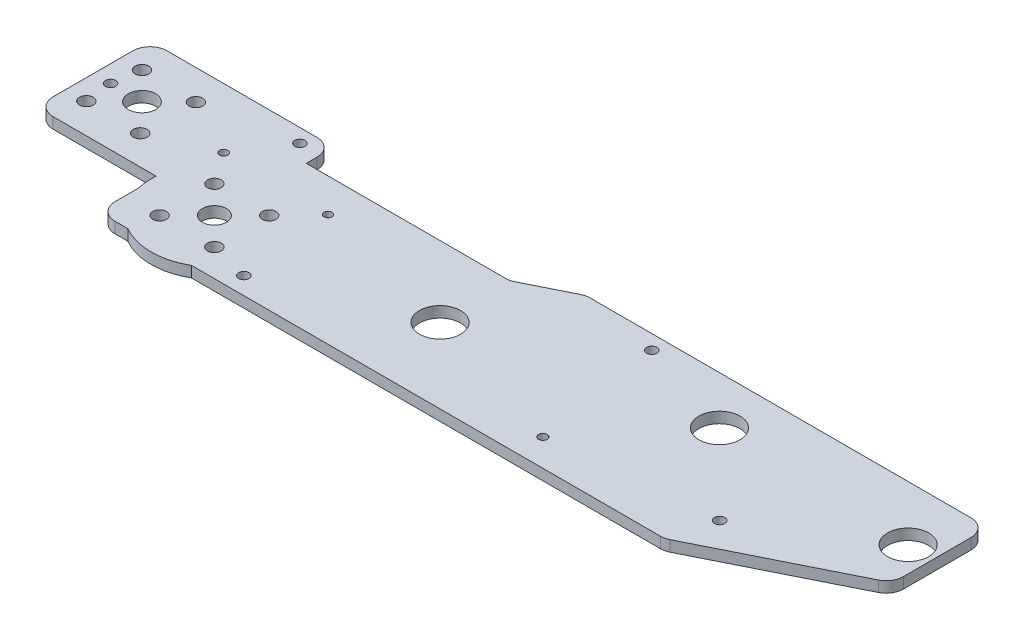
from build123d import *

# Parameters (mm, degrees)
SKETCH1_W           = 210
SKETCH1_H           = 50
SKETCH1_R           = 1.211665018
SKETCH1_R_2         = 1.165617118
SKETCH1_R_3         = 1.5
SKETCH1_R_4         = 1.25
SKETCH1_R_5         = 1.517273905
SKETCH1_R_6         = 3.4
BOSS_EXTRUDE1_DEPTH = 3.175
SKETCH2_R           = 2
CUT_EXTRUDE1_DEPTH  = 10
SKETCH3_R           = 6
SKETCH3_R_2         = 0.586995366
CUT_EXTRUDE2_DEPTH  = 57.15
CUT_EXTRUDE7_DEPTH  = 10
FILLET3_R           = 5
SKETCH11_R          = 18.5
SKETCH11_R_2        = 2
BOSS_EXTRUDE4_DEPTH = 3.175
SKETCH16_W          = 18.257640281
SKETCH16_H          = 3.175
BOSS_EXTRUDE7_DEPTH = 8.128
SKETCH17_W          = 33.3
SKETCH17_H          = 3.175
BOSS_EXTRUDE8_DEPTH = 35.56
SKETCH18_R          = 2
CUT_EXTRUDE8_DEPTH  = 9
SKETCH19_R          = 4
CUT_EXTRUDE9_DEPTH  = 40
FILLET4_R           = 5
SKETCH20_R          = 3.5
CUT_EXTRUDE10_DEPTH = 10
SKETCH21_R          = 1.5
CUT_EXTRUDE11_DEPTH = 10
SKETCH22_R          = 1.5
CUT_EXTRUDE12_DEPTH = 10
SKETCH24_R          = 1.5
CUT_EXTRUDE13_DEPTH = 10


with BuildPart() as part:
    # Sketch1 → Boss-Extrude1 (new body)
    with BuildSketch(Plane(origin=(0, 0, 0), x_dir=(1, 0, 0), z_dir=(0, 1, 0))):
        with Locations((105, -25)):
            Rectangle(SKETCH1_W, SKETCH1_H)
        with Locations((3.489526233, -16.787661112)):
            Circle(SKETCH1_R, mode=Mode.SUBTRACT)
        with Locations((34.37258772, -17.194005245)):
            Circle(SKETCH1_R_2, mode=Mode.SUBTRACT)
        with Locations((37.520749958, -44.921198121)):
            Circle(SKETCH1_R_3, mode=Mode.SUBTRACT)
        with Locations((122, -42.058139805)):
            Circle(SKETCH1_R_4, mode=Mode.SUBTRACT)
        with Locations((168.975233936, -37.403209633)):
            Circle(SKETCH1_R_5, mode=Mode.SUBTRACT)
        with Locations((78.01026379, -28.1)):
            Circle(SKETCH1_R_6, mode=Mode.SUBTRACT)
    extrude(amount=BOSS_EXTRUDE1_DEPTH)

    # Sketch2 → Cut-Extrude1 (cut)
    with BuildSketch(Plane(origin=(0, 3.175, 0), x_dir=(1, 0, 0), z_dir=(0, 1, 0))):
        with Locations((10, -26)):
            Circle(SKETCH2_R)
        with Locations((10, -42)):
            Circle(SKETCH2_R)
        with Locations((26, -26)):
            Circle(SKETCH2_R)
        with Locations((26, -42)):
            Circle(SKETCH2_R)
    extrude(amount=-CUT_EXTRUDE1_DEPTH, mode=Mode.SUBTRACT)

    # Sketch3 → Cut-Extrude2 (cut)
    with BuildSketch(Plane(origin=(0, 3.175, 0), x_dir=(1, 0, 0), z_dir=(0, 1, 0))):
        with Locations((78.01026379, -28.1)):
            Circle(SKETCH3_R)
        with Locations((145.531297368, -14)):
            Circle(SKETCH3_R)
        with Locations((18, -34)):
            Circle(SKETCH3_R_2)
        with Locations((202.646291021, -16)):
            Circle(SKETCH3_R)
    extrude(amount=-CUT_EXTRUDE2_DEPTH, mode=Mode.SUBTRACT)

    # Sketch10 → Cut-Extrude7 (cut)
    with BuildSketch(Plane(origin=(0, 3.175, 0), x_dir=(1, 0, 0), z_dir=(0, 1, 0))):
        Polygon((210, -27.859435908), (165.502877994, -50), (210, -50), align=None)
        Polygon((92.532613397, 0), (77.65477062, -7.402812063), (0, -7.402812063), (0, 0), align=None)
    extrude(amount=-CUT_EXTRUDE7_DEPTH, mode=Mode.SUBTRACT)

    # Fillet3
    fillet3_edges = [part.edges().sort_by_distance(p)[0] for p in [
        (77.65477062, 1.5875, 7.402812063),
        (92.532613397, 1.5875, 0),
        (210, 1.5875, 0),
        (210, 1.5875, 27.859435908),
        (165.502877994, 1.5875, 50),
    ]]
    fillet(fillet3_edges, radius=FILLET3_R)

    # Sketch11 → Boss-Extrude4 (add)
    with BuildSketch(Plane(origin=(0, 3.175, 0), x_dir=(1, 0, 0), z_dir=(0, 1, 0))):
        with Locations((18, -34)):
            Circle(SKETCH11_R)
        with Locations((10, -26)):
            Circle(SKETCH11_R_2, mode=Mode.SUBTRACT)
        with Locations((10, -42)):
            Circle(SKETCH11_R_2, mode=Mode.SUBTRACT)
        with Locations((26, -26)):
            Circle(SKETCH11_R_2, mode=Mode.SUBTRACT)
        with Locations((26, -42)):
            Circle(SKETCH11_R_2, mode=Mode.SUBTRACT)
    extrude(amount=-BOSS_EXTRUDE4_DEPTH)

    # Sketch16 → Boss-Extrude7 (add)
    with BuildSketch(Plane(origin=(0, 0, 7.402812063), x_dir=(-1, 0, 0), z_dir=(0, 0, -1))):
        with Locations((-9.128820141, 1.5875)):
            Rectangle(SKETCH16_W, SKETCH16_H)
    extrude(amount=BOSS_EXTRUDE7_DEPTH)

    # Sketch17 → Boss-Extrude8 (add)
    with BuildSketch(Plane.ZY):
        with Locations((15.924812063, 1.5875)):
            Rectangle(SKETCH17_W, SKETCH17_H)
    extrude(amount=BOSS_EXTRUDE8_DEPTH)

    # Sketch18 → Cut-Extrude8 (cut)
    with BuildSketch(Plane(origin=(0, 3.175, 0), x_dir=(1, 0, 0), z_dir=(0, 1, 0))):
        with Locations((-29.612034681, -23.798543698)):
            Circle(SKETCH18_R)
        with Locations((-29.359661767, -7.798707515)):
            Circle(SKETCH18_R)
        with Locations((-13.359825583, -8.051080428)):
            Circle(SKETCH18_R)
        with Locations((-13.612198497, -24.050916612)):
            Circle(SKETCH18_R)
    extrude(amount=-CUT_EXTRUDE8_DEPTH, mode=Mode.SUBTRACT)

    # Sketch19 → Cut-Extrude9 (cut)
    with BuildSketch(Plane(origin=(0, 3.175, 0), x_dir=(1, 0, 0), z_dir=(0, 1, 0))):
        with Locations((-21.359661767, -15.798707515)):
            Circle(SKETCH19_R)
    extrude(amount=-CUT_EXTRUDE9_DEPTH, mode=Mode.SUBTRACT)

    # Fillet4
    fillet4_edges = [part.edges().sort_by_distance(p)[0] for p in [
        (0, 1.5875, 50),
        (18.257640281, 1.5875, -0.725187937),
        (-35.56, 1.5875, -0.725187937),
        (-35.56, 1.5875, 32.574812063),
    ]]
    fillet(fillet4_edges, radius=FILLET4_R)

    # Sketch20 → Cut-Extrude10 (cut)
    with BuildSketch(Plane(origin=(0, 3.175, 0), x_dir=(1, 0, 0), z_dir=(0, 1, 0))):
        with Locations((18, -34)):
            Circle(SKETCH20_R)
    extrude(amount=-CUT_EXTRUDE10_DEPTH, mode=Mode.SUBTRACT)

    # Sketch21 → Cut-Extrude11 (cut)
    with BuildSketch(Plane(origin=(0, 3.175, 0), x_dir=(1, 0, 0), z_dir=(0, 1, 0))):
        with Locations((116, -4.237214774)):
            Circle(SKETCH21_R)
    extrude(amount=-CUT_EXTRUDE11_DEPTH, mode=Mode.SUBTRACT)

    # Sketch22 → Cut-Extrude12 (cut)
    with BuildSketch(Plane(origin=(0, 3.175, 0), x_dir=(1, 0, 0), z_dir=(0, 1, 0))):
        with Locations((12.257640281, -3.274812063)):
            Circle(SKETCH22_R)
    extrude(amount=-CUT_EXTRUDE12_DEPTH, mode=Mode.SUBTRACT)

    # Sketch24 → Cut-Extrude13 (cut)
    with BuildSketch(Plane(origin=(0, 3.175, 0), x_dir=(1, 0, 0), z_dir=(0, 1, 0))):
        with Locations((-30.56, -15.774812063)):
            Circle(SKETCH24_R)
    extrude(amount=-CUT_EXTRUDE13_DEPTH, mode=Mode.SUBTRACT)


solid = part.part
